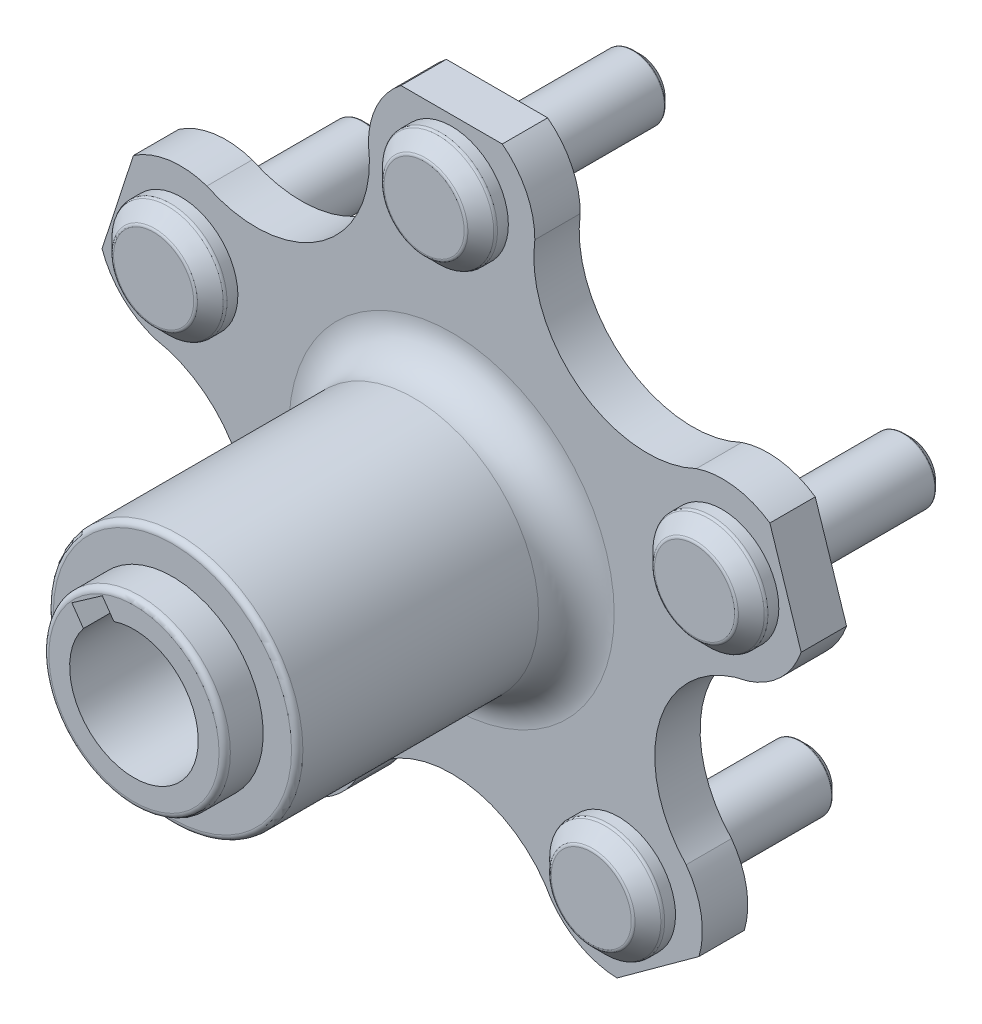
from build123d import *

# Parameters (mm, degrees)
SKETCH2_R           = 16.5
SKETCH2_R_2         = 4.214519236
BOSS_EXTRUDE1_DEPTH = 6
SKETCH3_R           = 16.5
SKETCH3_R_2         = 12
BOSS_EXTRUDE3_DEPTH = 42.07
SKETCH3_4_R         = 12
BOSS_EXTRUDE4_DEPTH = 47.16
FILLET1_R           = 5
FILLET2_R           = 0.75
SKETCH4_W           = 19.06341868
SKETCH4_H           = 5.165201456
CUT_EXTRUDE1_DEPTH  = 47.16
FILLET3_R           = 0.75
FILLET4_R           = 1
SKETCH5_R           = 7.5
SKETCH5_R_2         = 4.214519236
BOSS_EXTRUDE5_DEPTH = 3.64
BOSS_EXTRUDE6_START = -25
SKETCH5_3_R         = 4.214519236
BOSS_EXTRUDE6_DEPTH = 25
CHAMFER1_SIZE       = 1
FILLET6_R           = 0.2
CHAMFER2_SIZE       = 2
FILLET7_R           = 0.5
FILLET8_R           = 0.5
CIRPATTERN1_COUNT   = 5


with BuildPart() as part:
    # Sketch2 → Boss-Extrude1 (new body)
    with BuildSketch(Plane.XY):
        with BuildLine():
            ThreePointArc((11, 37.6), (17.049552222, 23.46669543), (32.360538075, 22.080660668))
            ThreePointArc((32.360538075, 22.080660668), (46.306941778, 15.046037456), (39.158911951, 1.157417309))
            ThreePointArc((39.158911951, 1.157417309), (27.586754987, -8.963480051), (30.999912424, -23.953401213))
            ThreePointArc((30.999912424, -23.953401213), (28.619263934, -39.391037456), (13.201538548, -36.884676764))
            ThreePointArc((13.201538548, -36.884676764), (0, -29.006430759), (-13.201538548, -36.884676764))
            ThreePointArc((-13.201538548, -36.884676764), (-28.619263934, -39.391037456), (-30.999912424, -23.953401213))
            ThreePointArc((-30.999912424, -23.953401213), (-27.586754987, -8.963480051), (-39.158911951, 1.157417309))
            ThreePointArc((-39.158911951, 1.157417309), (-46.306941778, 15.046037456), (-32.360538075, 22.080660668))
            ThreePointArc((-32.360538075, 22.080660668), (-17.049552222, 23.46669543), (-11, 37.6))
            ThreePointArc((-11, 37.6), (0, 48.69), (11, 37.6))
        make_face()
        Circle(SKETCH2_R, mode=Mode.SUBTRACT)
        with Locations((0, 37.6)):
            Circle(SKETCH2_R_2, mode=Mode.SUBTRACT)
        with Locations((35.759725013, 11.619038988)):
            Circle(SKETCH2_R_2, mode=Mode.SUBTRACT)
        with Locations((22.100725486, -30.419038988)):
            Circle(SKETCH2_R_2, mode=Mode.SUBTRACT)
        with Locations((-22.100725486, -30.419038988)):
            Circle(SKETCH2_R_2, mode=Mode.SUBTRACT)
        with Locations((-35.759725013, 11.619038988)):
            Circle(SKETCH2_R_2, mode=Mode.SUBTRACT)
    extrude(amount=BOSS_EXTRUDE1_DEPTH)

    # Sketch3 → Boss-Extrude3 (add)
    # profile 1 of 2: a face of its own
    with BuildSketch(Plane.XY.offset(0.84)):
        Circle(SKETCH3_R)
        Circle(SKETCH3_R_2, mode=Mode.SUBTRACT)
    # profile 2 of 2: a face of its own
    with BuildSketch(Plane.XY.offset(0.84)):
        Circle(SKETCH3_R_2)
        with BuildLine():
            ThreePointArc((-6.679290329, 5.257098125), (4.875399709, -6.962792376), (-2.65560448, 8.074513289))
            Line((-2.65560448, 8.074513289), (-4.182782588, 10.25554966))
            Line((-4.182782588, 10.25554966), (-8.206468437, 7.438134497))
            Line((-8.206468437, 7.438134497), (-6.679290329, 5.257098125))
        make_face(mode=Mode.SUBTRACT)
    extrude(amount=BOSS_EXTRUDE3_DEPTH)

    # Sketch3<4> → Boss-Extrude4 (add)
    with BuildSketch(Plane.XY.offset(0.84)):
        with Locations(Location((0, 0, 0), (0, 0, 180))):
            Circle(SKETCH3_4_R)
        with BuildLine():
            ThreePointArc((-6.679290329, 5.257098125), (4.875399709, -6.962792376), (-2.65560448, 8.074513289))
            Line((-2.65560448, 8.074513289), (-4.182782588, 10.25554966))
            Line((-4.182782588, 10.25554966), (-8.206468437, 7.438134497))
            Line((-8.206468437, 7.438134497), (-6.679290329, 5.257098125))
        make_face(mode=Mode.SUBTRACT)
    extrude(amount=BOSS_EXTRUDE4_DEPTH)

    # Fillet1
    fillet1_edges = [part.edges().sort_by_distance(p)[0] for p in [
        (-16.5, 0, 6),
    ]]
    fillet(fillet1_edges, radius=FILLET1_R)

    # Fillet2
    fillet2_edges = [part.edges().sort_by_distance(p)[0] for p in [
        (-16.5, 0, 42.91),
    ]]
    fillet(fillet2_edges, radius=FILLET2_R)

    # Sketch4 → Cut-Extrude1 (cut)
    with BuildSketch(Plane.XY):
        Polygon((46.112508378, 25.005094519), (52.003428721, 6.874705959), (47.091030219, 5.27857093), (41.200109876, 23.408959489), align=None)
        with Locations((0, 49)):
            Rectangle(SKETCH4_W, SKETCH4_H)
        Polygon((38.030806824, -36.128602423), (22.608177141, -47.333798782), (19.5721479, -43.155063025), (34.994777584, -31.949866667), align=None)
        Polygon((-22.608177141, -47.333798782), (-38.030806824, -36.128602423), (-34.994777584, -31.949866667), (-19.5721479, -43.155063025), align=None)
        Polygon((-52.003428721, 6.874705959), (-46.112508378, 25.005094519), (-41.200109876, 23.408959489), (-47.091030219, 5.27857093), align=None)
    extrude(amount=CUT_EXTRUDE1_DEPTH, mode=Mode.SUBTRACT)

    # Fillet3
    fillet3_edges = [part.edges().sort_by_distance(p)[0] for p in [
        (12, 0, 48),
    ]]
    fillet(fillet3_edges, radius=FILLET3_R)

    # Fillet4
    # the kernel refuses this fillet: 1 mm, written as the material it adds along each edge
    with BuildSketch(Plane(origin=(0, 0, 0.84), x_dir=(1, 0, 0), z_dir=(0, -1, 0))) as fillet4_piece_1:
        with BuildLine():
            CenterArc((15.512882986, -1), FILLET4_R, 9.206896221, 80.793103779)
            Line((16.5, -0.84), (16.51974234, -0.8368))
            ThreePointArc((16.51974234, -0.8368), (16.52, -0.42), (16.52, 0))
            Line((16.52, 0), (16.5, 0.02))
            Line((16.5, 0.02), (15.512882986, 0.02))
            Line((15.512882986, 0.02), (15.512882986, 0))
        make_face()
    revolve(axis=Axis((0, 0, 0.84), (0, 0, 1)))


with BuildPart() as body_2:
    # Sketch5 → Boss-Extrude5 (new body)
    # profile 1 of 2: a face of its own
    with BuildSketch(Plane.XY.offset(6)):
        with Locations((0, 37.6)):
            Circle(SKETCH5_R)
        with Locations((0, 37.6)):
            Circle(SKETCH5_R_2, mode=Mode.SUBTRACT)
    # profile 2 of 2: a face of its own
    with BuildSketch(Plane.XY.offset(6)):
        with Locations((0, 37.6)):
            Circle(SKETCH5_R_2)
    extrude(amount=BOSS_EXTRUDE5_DEPTH)

    # Sketch5<3> → Boss-Extrude6 (add)
    with BuildSketch(Plane.XY.offset(6).offset(BOSS_EXTRUDE6_START)):
        with Locations((0, 37.6)):
            Circle(SKETCH5_3_R)
    extrude(amount=BOSS_EXTRUDE6_DEPTH)

    # Chamfer1
    chamfer1_edges = [body_2.edges().sort_by_distance(p)[0] for p in [
        (-4.214519236, 37.6, -19),
    ]]
    chamfer(chamfer1_edges, length=CHAMFER1_SIZE)

    # Fillet6
    fillet6_edges = [body_2.edges().sort_by_distance(p)[0] for p in [
        (-4.214519236, 37.6, -18),
        (-3.214519236, 37.6, -19),
    ]]
    fillet(fillet6_edges, radius=FILLET6_R)

    # Chamfer2
    chamfer2_edges = [body_2.edges().sort_by_distance(p)[0] for p in [
        (-7.5, 37.6, 9.64),
    ]]
    chamfer(chamfer2_edges, length=CHAMFER2_SIZE)

    # Fillet7
    fillet7_edges = [body_2.edges().sort_by_distance(p)[0] for p in [
        (-7.5, 37.6, 7.64),
    ]]
    fillet(fillet7_edges, radius=FILLET7_R)

    # Fillet8
    fillet8_edges = [body_2.edges().sort_by_distance(p)[0] for p in [
        (-5.5, 37.6, 9.64),
    ]]
    fillet(fillet8_edges, radius=FILLET8_R)


with BuildPart() as cirpattern1_1:
    # CirPattern1: pattern copy
    add(body_2.part.rotate(Axis((0, 0, 0), (0, 0, 1)), 1 * 360 / CIRPATTERN1_COUNT))


with BuildPart() as cirpattern1_2:
    # CirPattern1: pattern copy
    add(body_2.part.rotate(Axis((0, 0, 0), (0, 0, 1)), 2 * 360 / CIRPATTERN1_COUNT))


with BuildPart() as cirpattern1_3:
    # CirPattern1: pattern copy
    add(body_2.part.rotate(Axis((0, 0, 0), (0, 0, 1)), 3 * 360 / CIRPATTERN1_COUNT))


with BuildPart() as cirpattern1_4:
    # CirPattern1: pattern copy
    add(body_2.part.rotate(Axis((0, 0, 0), (0, 0, 1)), 4 * 360 / CIRPATTERN1_COUNT))


solid = Compound([part.part, body_2.part, cirpattern1_1.part, cirpattern1_2.part, cirpattern1_3.part, cirpattern1_4.part])
